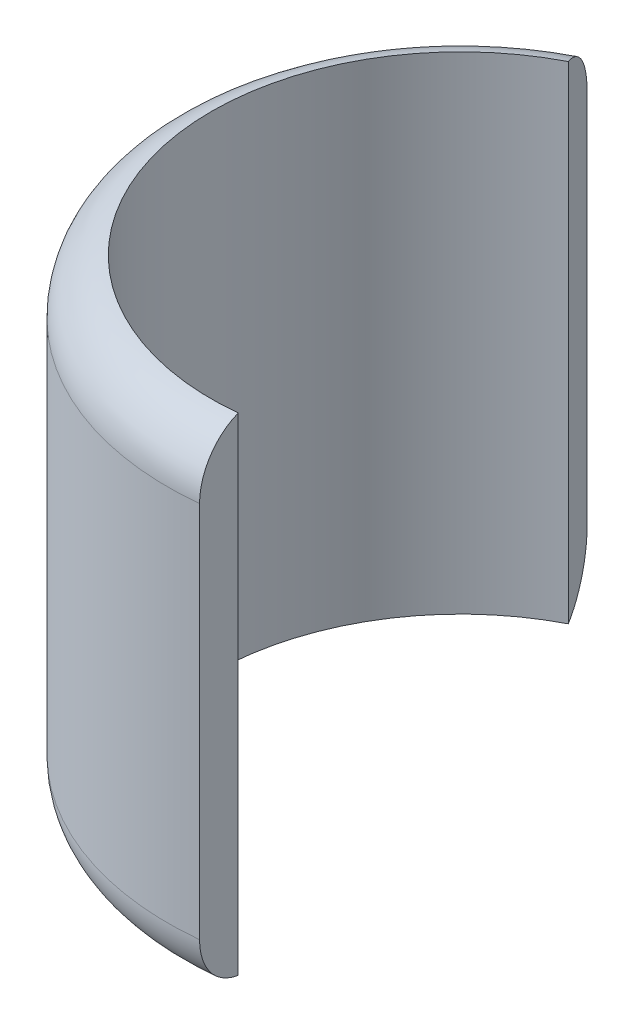
from build123d import *

# Parameters (mm, degrees)
BOSS_EXTRUDE1_DEPTH = 33.23
FILLET1_R           = 3.83


with BuildPart() as part:
    # Sketch1 → Boss-Extrude1 (new body)
    with BuildSketch(Plane(origin=(0, 0, 0), x_dir=(1, 0, 0), z_dir=(0, 1, 0))):
        with BuildLine():
            Line((2.042655155, -19.855204857), (1.739736354, -16.91074562))
            ThreePointArc((1.739736354, -16.91074562), (-16.297085527, -4.837871775), (-7.769024925, 15.120920994))
            Line((-7.769024925, 15.120920994), (-9.121749265, 17.753740179))
            ThreePointArc((-9.121749265, 17.753740179), (-19.134695713, -5.680230625), (2.042655155, -19.855204857))
        make_face()
    extrude(amount=BOSS_EXTRUDE1_DEPTH)

    # Fillet1
    # the kernel refuses this fillet: 3.83 mm, written as the material it takes off along each edge
    with BuildSketch(Plane(origin=(0, 0, 0), x_dir=(-0.006868077276749461, 0, -0.9999764144791219), z_dir=(0.9999764144791219, 0, -0.006868077276749461))) as fillet1_piece_1:
        with BuildLine():
            CenterArc((16.13, 3.729879355), FILLET1_R, 283.129576281, 76.870423719)
            Line((17, 0), (17.0174, -0.074597587))
            ThreePointArc((17.0174, -0.074597587), (18.48, -0.0766), (19.96, -0.0766))
            Line((19.96, -0.0766), (20.0366, 0))
            Line((20.0366, 0), (20.0366, 3.729879355))
            Line((20.0366, 3.729879355), (19.96, 3.729879355))
        make_face()
    revolve(axis=Axis((0, 0, 0), (0, 1, 0)), revolution_arc=212.280542546, mode=Mode.SUBTRACT)
    with BuildSketch(Plane(origin=(0, 33.23, 0), x_dir=(-0.006868077276749906, 0, -0.9999764144791219), z_dir=(0.9999764144791219, 0, -0.006868077276749906))) as fillet1_piece_2:
        with BuildLine():
            CenterArc((16.13, -3.729879355), FILLET1_R, 0, 76.870423719)
            Line((17, 0), (17.0174, 0.074597587))
            ThreePointArc((17.0174, 0.074597587), (18.48, 0.0766), (19.96, 0.0766))
            Line((19.96, 0.0766), (20.0366, 0))
            Line((20.0366, 0), (20.0366, -3.729879355))
            Line((20.0366, -3.729879355), (19.96, -3.729879355))
        make_face()
    revolve(axis=Axis((0, 33.23, 0), (0, 1, 0)), revolution_arc=212.280542546, mode=Mode.SUBTRACT)


solid = part.part
